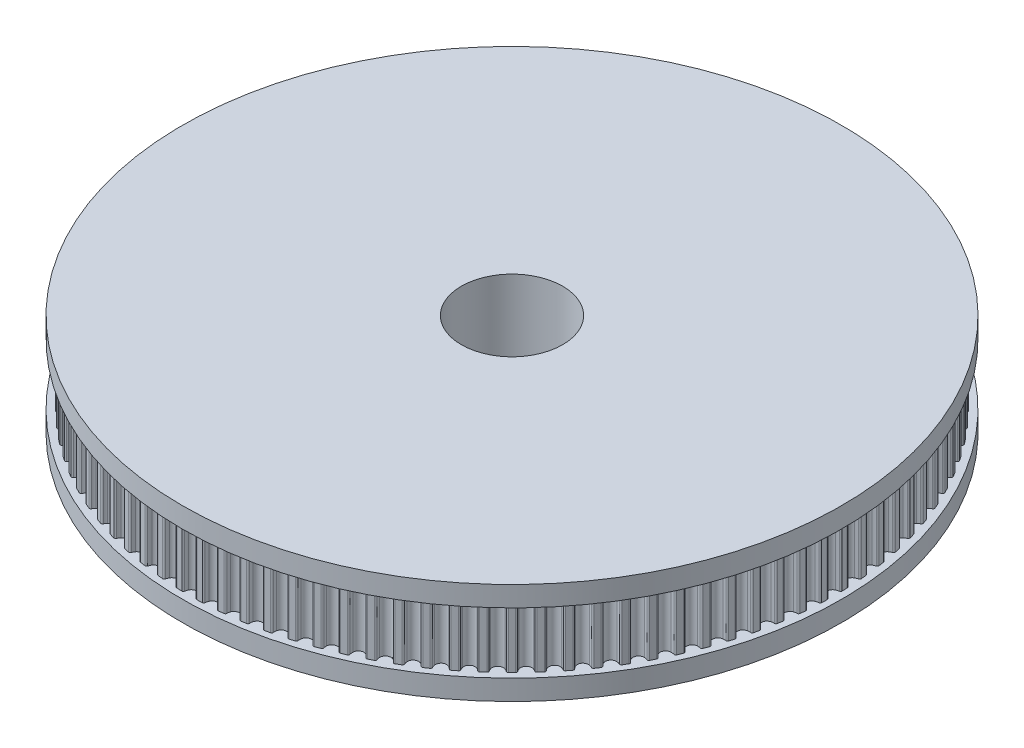
from build123d import *

# Parameters (mm, degrees)
SKETCH1_R           = 5
BOSS_EXTRUDE1_DEPTH = 12
SKETCH2_R           = 5
BOSS_EXTRUDE2_DEPTH = 8
SKETCH3_R           = 7.5
SKETCH3_R_2         = 5
BOSS_EXTRUDE3_DEPTH = 1
SKETCH4_R           = 32.5
SKETCH4_R_2         = 5
BOSS_EXTRUDE4_DEPTH = 1
SKETCH5_R           = 32.5
SKETCH5_R_2         = 5
BOSS_EXTRUDE5_DEPTH = 1


with BuildPart() as part:
    # Sketch1 → Boss-Extrude1 (new body)
    with BuildSketch(Plane(origin=(0, 0, 0), x_dir=(1, 0, 0), z_dir=(0, 1, 0))):
        with BuildLine():
            ThreePointArc((-0.582708394, 6.196392216), (-0.640340953, 6.292497599), (-0.748491413, 6.321844399))
            ThreePointArc((-0.748491413, 6.321844399), (-0.995861804, 6.287623976), (-1.24169972, 6.243727877))
            ThreePointArc((-1.24169972, 6.243727877), (-1.335488259, 6.182397082), (-1.360601883, 6.073185991))
            ThreePointArc((-1.360601883, 6.073185991), (-1.348626745, 5.941196423), (-1.354211129, 5.808782433))
            ThreePointArc((-1.354211129, 5.808782433), (-1.735130423, 5.340182339), (-2.31873683, 5.495389035))
            ThreePointArc((-2.31873683, 5.495389035), (-2.401085682, 5.599231785), (-2.468979114, 5.713052398))
            ThreePointArc((-2.468979114, 5.713052398), (-2.553489131, 5.786644609), (-2.66541499, 5.781134744))
            ThreePointArc((-2.66541499, 5.781134744), (-2.890103521, 5.672147533), (-3.110344632, 5.554431768))
            ThreePointArc((-3.110344632, 5.554431768), (-3.180590575, 5.467120463), (-3.170726968, 5.355494007))
            ThreePointArc((-3.170726968, 5.355494007), (-3.118550916, 5.233664989), (-3.082943807, 5.106006132))
            ThreePointArc((-3.082943807, 5.106006132), (-3.300414192, 4.542630423), (-3.903418375, 4.509896465))
            ThreePointArc((-3.903418375, 4.509896465), (-4.013825961, 4.583209594), (-4.113568955, 4.670479206))
            ThreePointArc((-4.113568955, 4.670479206), (-4.216684002, 4.714354526), (-4.321429178, 4.674527341))
            ThreePointArc((-4.321429178, 4.674527341), (-4.501441769, 4.501441769), (-4.674527341, 4.321429178))
            ThreePointArc((-4.674527341, 4.321429178), (-4.714354526, 4.216684002), (-4.670479206, 4.113568955))
            ThreePointArc((-4.670479206, 4.113568955), (-4.583209594, 4.013825961), (-4.509896465, 3.903418375))
            ThreePointArc((-4.509896465, 3.903418375), (-4.542630423, 3.300414192), (-5.106006132, 3.082943807))
            ThreePointArc((-5.106006132, 3.082943807), (-5.233664989, 3.118550916), (-5.355494007, 3.170726968))
            ThreePointArc((-5.355494007, 3.170726968), (-5.467120463, 3.180590575), (-5.554431768, 3.110344632))
            ThreePointArc((-5.554431768, 3.110344632), (-5.672147533, 2.890103521), (-5.781134744, 2.66541499))
            ThreePointArc((-5.781134744, 2.66541499), (-5.786644609, 2.553489131), (-5.713052398, 2.468979114))
            ThreePointArc((-5.713052398, 2.468979114), (-5.599231785, 2.401085682), (-5.495389035, 2.31873683))
            ThreePointArc((-5.495389035, 2.31873683), (-5.340182339, 1.735130423), (-5.808782433, 1.354211129))
            ThreePointArc((-5.808782433, 1.354211129), (-5.941196423, 1.348626745), (-6.073185991, 1.360601883))
            ThreePointArc((-6.073185991, 1.360601883), (-6.182397082, 1.335488259), (-6.243727877, 1.24169972))
            ThreePointArc((-6.243727877, 1.24169972), (-6.287623976, 0.995861804), (-6.321844399, 0.748491413))
            ThreePointArc((-6.321844399, 0.748491413), (-6.292497599, 0.640340953), (-6.196392216, 0.582708394))
            ThreePointArc((-6.196392216, 0.582708394), (-6.067162156, 0.553310407), (-5.942954637, 0.50708117))
            ThreePointArc((-5.942954637, 0.50708117), (-5.615, 0), (-5.942954637, -0.50708117))
            ThreePointArc((-5.942954637, -0.50708117), (-6.067162156, -0.553310407), (-6.196392216, -0.582708394))
            ThreePointArc((-6.196392216, -0.582708394), (-6.292497599, -0.640340953), (-6.321844399, -0.748491413))
            ThreePointArc((-6.321844399, -0.748491413), (-6.287623976, -0.995861804), (-6.243727877, -1.24169972))
            ThreePointArc((-6.243727877, -1.24169972), (-6.182397082, -1.335488259), (-6.073185991, -1.360601883))
            ThreePointArc((-6.073185991, -1.360601883), (-5.941196423, -1.348626745), (-5.808782433, -1.354211129))
            ThreePointArc((-5.808782433, -1.354211129), (-5.340182339, -1.735130423), (-5.495389035, -2.31873683))
            ThreePointArc((-5.495389035, -2.31873683), (-5.599231785, -2.401085682), (-5.713052398, -2.468979114))
            ThreePointArc((-5.713052398, -2.468979114), (-5.786644609, -2.553489131), (-5.781134744, -2.66541499))
            ThreePointArc((-5.781134744, -2.66541499), (-5.672147533, -2.890103521), (-5.554431768, -3.110344632))
            ThreePointArc((-5.554431768, -3.110344632), (-5.467120463, -3.180590575), (-5.355494007, -3.170726968))
            ThreePointArc((-5.355494007, -3.170726968), (-5.233664989, -3.118550916), (-5.106006132, -3.082943807))
            ThreePointArc((-5.106006132, -3.082943807), (-4.542630423, -3.300414192), (-4.509896465, -3.903418375))
            ThreePointArc((-4.509896465, -3.903418375), (-4.583209594, -4.013825961), (-4.670479206, -4.113568955))
            ThreePointArc((-4.670479206, -4.113568955), (-4.714354526, -4.216684002), (-4.674527341, -4.321429178))
            ThreePointArc((-4.674527341, -4.321429178), (-4.501441769, -4.501441769), (-4.321429178, -4.674527341))
            ThreePointArc((-4.321429178, -4.674527341), (-4.216684002, -4.714354526), (-4.113568955, -4.670479206))
            ThreePointArc((-4.113568955, -4.670479206), (-4.013825961, -4.583209594), (-3.903418375, -4.509896465))
            ThreePointArc((-3.903418375, -4.509896465), (-3.300414192, -4.542630423), (-3.082943807, -5.106006132))
            ThreePointArc((-3.082943807, -5.106006132), (-3.118550916, -5.233664989), (-3.170726968, -5.355494007))
            ThreePointArc((-3.170726968, -5.355494007), (-3.180590575, -5.467120463), (-3.110344632, -5.554431768))
            ThreePointArc((-3.110344632, -5.554431768), (-2.890103521, -5.672147533), (-2.66541499, -5.781134744))
            ThreePointArc((-2.66541499, -5.781134744), (-2.553489131, -5.786644609), (-2.468979114, -5.713052398))
            ThreePointArc((-2.468979114, -5.713052398), (-2.401085682, -5.599231785), (-2.31873683, -5.495389035))
            ThreePointArc((-2.31873683, -5.495389035), (-1.735130423, -5.340182339), (-1.354211129, -5.808782433))
            ThreePointArc((-1.354211129, -5.808782433), (-1.348626745, -5.941196423), (-1.360601883, -6.073185991))
            ThreePointArc((-1.360601883, -6.073185991), (-1.335488259, -6.182397082), (-1.24169972, -6.243727877))
            ThreePointArc((-1.24169972, -6.243727877), (-0.995861804, -6.287623976), (-0.748491413, -6.321844399))
            ThreePointArc((-0.748491413, -6.321844399), (-0.640340953, -6.292497599), (-0.582708394, -6.196392216))
            ThreePointArc((-0.582708394, -6.196392216), (-0.553310407, -6.067162156), (-0.50708117, -5.942954637))
            ThreePointArc((-0.50708117, -5.942954637), (0, -5.615), (0.50708117, -5.942954637))
            ThreePointArc((0.50708117, -5.942954637), (0.553310407, -6.067162156), (0.582708394, -6.196392216))
            ThreePointArc((0.582708394, -6.196392216), (0.640340953, -6.292497599), (0.748491413, -6.321844399))
            ThreePointArc((0.748491413, -6.321844399), (0.995861804, -6.287623976), (1.24169972, -6.243727877))
            ThreePointArc((1.24169972, -6.243727877), (1.335488259, -6.182397082), (1.360601883, -6.073185991))
            ThreePointArc((1.360601883, -6.073185991), (1.348626745, -5.941196423), (1.354211129, -5.808782433))
            ThreePointArc((1.354211129, -5.808782433), (1.735130423, -5.340182339), (2.31873683, -5.495389035))
            ThreePointArc((2.31873683, -5.495389035), (2.401085682, -5.599231785), (2.468979114, -5.713052398))
            ThreePointArc((2.468979114, -5.713052398), (2.553489131, -5.786644609), (2.66541499, -5.781134744))
            ThreePointArc((2.66541499, -5.781134744), (2.890103521, -5.672147533), (3.110344632, -5.554431768))
            ThreePointArc((3.110344632, -5.554431768), (3.180590575, -5.467120463), (3.170726968, -5.355494007))
            ThreePointArc((3.170726968, -5.355494007), (3.118550916, -5.233664989), (3.082943807, -5.106006132))
            ThreePointArc((3.082943807, -5.106006132), (3.300414192, -4.542630423), (3.903418375, -4.509896465))
            ThreePointArc((3.903418375, -4.509896465), (4.013825961, -4.583209594), (4.113568955, -4.670479206))
            ThreePointArc((4.113568955, -4.670479206), (4.216684002, -4.714354526), (4.321429178, -4.674527341))
            ThreePointArc((4.321429178, -4.674527341), (4.501441769, -4.501441769), (4.674527341, -4.321429178))
            ThreePointArc((4.674527341, -4.321429178), (4.714354526, -4.216684002), (4.670479206, -4.113568955))
            ThreePointArc((4.670479206, -4.113568955), (4.583209594, -4.013825961), (4.509896465, -3.903418375))
            ThreePointArc((4.509896465, -3.903418375), (4.542630423, -3.300414192), (5.106006132, -3.082943807))
            ThreePointArc((5.106006132, -3.082943807), (5.233664989, -3.118550916), (5.355494007, -3.170726968))
            ThreePointArc((5.355494007, -3.170726968), (5.467120463, -3.180590575), (5.554431768, -3.110344632))
            ThreePointArc((5.554431768, -3.110344632), (5.672147533, -2.890103521), (5.781134744, -2.66541499))
            ThreePointArc((5.781134744, -2.66541499), (5.786644609, -2.553489131), (5.713052398, -2.468979114))
            ThreePointArc((5.713052398, -2.468979114), (5.599231785, -2.401085682), (5.495389035, -2.31873683))
            ThreePointArc((5.495389035, -2.31873683), (5.340182339, -1.735130423), (5.808782433, -1.354211129))
            ThreePointArc((5.808782433, -1.354211129), (5.941196423, -1.348626745), (6.073185991, -1.360601883))
            ThreePointArc((6.073185991, -1.360601883), (6.182397082, -1.335488259), (6.243727877, -1.24169972))
            ThreePointArc((6.243727877, -1.24169972), (6.287623976, -0.995861804), (6.321844399, -0.748491413))
            ThreePointArc((6.321844399, -0.748491413), (6.292497599, -0.640340953), (6.196392216, -0.582708394))
            ThreePointArc((6.196392216, -0.582708394), (6.067162156, -0.553310407), (5.942954637, -0.50708117))
            ThreePointArc((5.942954637, -0.50708117), (5.615, 0), (5.942954637, 0.50708117))
            ThreePointArc((5.942954637, 0.50708117), (6.067162156, 0.553310407), (6.196392216, 0.582708394))
            ThreePointArc((6.196392216, 0.582708394), (6.292497599, 0.640340953), (6.321844399, 0.748491413))
            ThreePointArc((6.321844399, 0.748491413), (6.287623976, 0.995861804), (6.243727877, 1.24169972))
            ThreePointArc((6.243727877, 1.24169972), (6.182397082, 1.335488259), (6.073185991, 1.360601883))
            ThreePointArc((6.073185991, 1.360601883), (5.941196423, 1.348626745), (5.808782433, 1.354211129))
            ThreePointArc((5.808782433, 1.354211129), (5.340182339, 1.735130423), (5.495389035, 2.31873683))
            ThreePointArc((5.495389035, 2.31873683), (5.599231785, 2.401085682), (5.713052398, 2.468979114))
            ThreePointArc((5.713052398, 2.468979114), (5.786644609, 2.553489131), (5.781134744, 2.66541499))
            ThreePointArc((5.781134744, 2.66541499), (5.672147533, 2.890103521), (5.554431768, 3.110344632))
            ThreePointArc((5.554431768, 3.110344632), (5.467120463, 3.180590575), (5.355494007, 3.170726968))
            ThreePointArc((5.355494007, 3.170726968), (5.233664989, 3.118550916), (5.106006132, 3.082943807))
            ThreePointArc((5.106006132, 3.082943807), (4.542630423, 3.300414192), (4.509896465, 3.903418375))
            ThreePointArc((4.509896465, 3.903418375), (4.583209594, 4.013825961), (4.670479206, 4.113568955))
            ThreePointArc((4.670479206, 4.113568955), (4.714354526, 4.216684002), (4.674527341, 4.321429178))
            ThreePointArc((4.674527341, 4.321429178), (4.501441769, 4.501441769), (4.321429178, 4.674527341))
            ThreePointArc((4.321429178, 4.674527341), (4.216684002, 4.714354526), (4.113568955, 4.670479206))
            ThreePointArc((4.113568955, 4.670479206), (4.013825961, 4.583209594), (3.903418375, 4.509896465))
            ThreePointArc((3.903418375, 4.509896465), (3.300414192, 4.542630423), (3.082943807, 5.106006132))
            ThreePointArc((3.082943807, 5.106006132), (3.118550916, 5.233664989), (3.170726968, 5.355494007))
            ThreePointArc((3.170726968, 5.355494007), (3.180590575, 5.467120463), (3.110344632, 5.554431768))
            ThreePointArc((3.110344632, 5.554431768), (2.890103521, 5.672147533), (2.66541499, 5.781134744))
            ThreePointArc((2.66541499, 5.781134744), (2.553489131, 5.786644609), (2.468979114, 5.713052398))
            ThreePointArc((2.468979114, 5.713052398), (2.401085682, 5.599231785), (2.31873683, 5.495389035))
            ThreePointArc((2.31873683, 5.495389035), (1.735130423, 5.340182339), (1.354211129, 5.808782433))
            ThreePointArc((1.354211129, 5.808782433), (1.348626745, 5.941196423), (1.360601883, 6.073185991))
            ThreePointArc((1.360601883, 6.073185991), (1.335488259, 6.182397082), (1.24169972, 6.243727877))
            ThreePointArc((1.24169972, 6.243727877), (0.995861804, 6.287623976), (0.748491413, 6.321844399))
            ThreePointArc((0.748491413, 6.321844399), (0.640340953, 6.292497599), (0.582708394, 6.196392216))
            ThreePointArc((0.582708394, 6.196392216), (0.553310407, 6.067162156), (0.50708117, 5.942954637))
            ThreePointArc((0.50708117, 5.942954637), (0, 5.615), (-0.50708117, 5.942954637))
            ThreePointArc((-0.50708117, 5.942954637), (-0.553310407, 6.067162156), (-0.582708394, 6.196392216))
        make_face()
        Circle(SKETCH1_R, mode=Mode.SUBTRACT)
    extrude(amount=BOSS_EXTRUDE1_DEPTH)

    # Sketch2 → Boss-Extrude2 (add)
    with BuildSketch(Plane(origin=(0, 12, 0), x_dir=(1, 0, 0), z_dir=(0, 1, 0))):
        with BuildLine():
            ThreePointArc((-0.590636451, 31.691736076), (-0.641969208, 31.785552728), (-0.742748164, 31.821332863))
            ThreePointArc((-0.742748164, 31.821332863), (-0.999804461, 31.814293816), (-1.256795502, 31.805178274))
            ThreePointArc((-1.256795502, 31.805178274), (-1.355128941, 31.76314078), (-1.400469608, 31.666286044))
            ThreePointArc((-1.400469608, 31.666286044), (-1.423990757, 31.512112674), (-1.471197102, 31.363471383))
            ThreePointArc((-1.471197102, 31.363471383), (-1.951466556, 31.017672693), (-2.471289011, 31.300550933))
            ThreePointArc((-2.471289011, 31.300550933), (-2.536752813, 31.44210362), (-2.579411538, 31.592113305))
            ThreePointArc((-2.579411538, 31.592113305), (-2.636533798, 31.68252162), (-2.739360543, 31.711903188))
            ThreePointArc((-2.739360543, 31.711903188), (-2.995467613, 31.688737333), (-3.251379171, 31.663503178))
            ThreePointArc((-3.251379171, 31.663503178), (-3.346879015, 31.615374228), (-3.386048654, 31.515863648))
            ThreePointArc((-3.386048654, 31.515863648), (-3.399842763, 31.360517599), (-3.437622693, 31.209205506))
            ThreePointArc((-3.437622693, 31.209205506), (-3.895231566, 30.833932802), (-4.431790341, 31.083612925))
            ThreePointArc((-4.431790341, 31.083612925), (-4.506013132, 31.220775784), (-4.558006866, 31.367810895))
            ThreePointArc((-4.558006866, 31.367810895), (-4.620693193, 31.454454074), (-4.725161917, 31.477321119))
            ThreePointArc((-4.725161917, 31.477321119), (-4.979309022, 31.438119881), (-5.233131132, 31.3968667))
            ThreePointArc((-5.233131132, 31.3968667), (-5.325420487, 31.342836236), (-5.358264512, 31.241062536))
            ThreePointArc((-5.358264512, 31.241062536), (-5.362277143, 31.085156887), (-5.390481557, 30.931771153))
            ThreePointArc((-5.390481557, 30.931771153), (-5.823623876, 30.528505465), (-6.37480142, 30.744002097))
            ThreePointArc((-6.37480142, 30.744002097), (-6.457490276, 30.876233809), (-6.518613823, 31.019714067))
            ThreePointArc((-6.518613823, 31.019714067), (-6.586616823, 31.102250168), (-6.692315236, 31.118512445))
            ThreePointArc((-6.692315236, 31.118512445), (-6.943499374, 31.063430533), (-7.194230314, 31.006321133))
            ThreePointArc((-7.194230314, 31.006321133), (-7.282944957, 30.946602389), (-7.309333748, 30.842967223))
            ThreePointArc((-7.309333748, 30.842967223), (-7.303549064, 30.687117263), (-7.322066654, 30.532263231))
            ThreePointArc((-7.322066654, 30.532263231), (-7.729033003, 30.102596065), (-8.29265407, 30.283058739))
            ThreePointArc((-8.29265407, 30.283058739), (-8.383482656, 30.409837445), (-8.453494789, 30.549196598))
            ThreePointArc((-8.453494789, 30.549196598), (-8.526546086, 30.62729989), (-8.633057044, 30.636893218))
            ThreePointArc((-8.633057044, 30.636893218), (-8.880286905, 30.566148015), (-9.126937157, 30.493407782))
            ThreePointArc((-9.126937157, 30.493407782), (-9.21172697, 30.428236441), (-9.231556384, 30.323148809))
            ThreePointArc((-9.231556384, 30.323148809), (-9.215997214, 30.167969607), (-9.224754899, 30.012258415))
            ThreePointArc((-9.224754899, 30.012258415), (-9.603939168, 29.55788547), (-10.177779402, 29.702601983))
            ThreePointArc((-10.177779402, 29.702601983), (-10.27638926, 29.823427346), (-10.355013674, 29.958115407))
            ThreePointArc((-10.355013674, 29.958115407), (-10.432824967, 30.031477651), (-10.53972812, 30.034364171))
            ThreePointArc((-10.53972812, 30.034364171), (-10.782028001, 29.948234876), (-11.023624148, 29.860150881))
            ThreePointArc((-11.023624148, 29.860150881), (-11.104154506, 29.789784145), (-11.117346283, 29.68365878))
            ThreePointArc((-11.117346283, 29.68365878), (-11.092074034, 29.529762757), (-11.09103725, 29.373808926))
            ThreePointArc((-11.09103725, 29.373808926), (-11.440942973, 28.896523405), (-12.022737689, 29.004922626))
            ThreePointArc((-12.022737689, 29.004922626), (-12.128739651, 29.119317804), (-12.21566605, 29.248803222))
            ThreePointArc((-12.21566605, 29.248803222), (-12.297930254, 29.31713489), (-12.404803704, 29.31330321))
            ThreePointArc((-12.404803704, 29.31330321), (-12.641217359, 29.212129736), (-12.876805931, 29.109049607))
            ThreePointArc((-12.876805931, 29.109049607), (-12.952759016, 29.03376518), (-12.959261096, 28.927020911))
            ThreePointArc((-12.959261096, 28.927020911), (-12.924375505, 28.775015425), (-12.913548345, 28.619434433))
            ThreePointArc((-12.913548345, 28.619434433), (-13.232794603, 28.121119964), (-13.820247723, 28.192774091))
            ThreePointArc((-13.820247723, 28.192774091), (-13.933223447, 28.300287618), (-14.028108774, 28.424059372))
            ThreePointArc((-14.028108774, 28.424059372), (-14.114501229, 28.487090791), (-14.220923195, 28.476556033))
            ThreePointArc((-14.220923195, 28.476556033), (-14.450517607, 28.360737665), (-14.679168844, 28.243068213))
            ThreePointArc((-14.679168844, 28.243068213), (-14.750244905, 28.163163209), (-14.750031626, 28.056221306))
            ThreePointArc((-14.750031626, 28.056221306), (-14.70567037, 27.906706252), (-14.685095564, 27.752112107))
            ThreePointArc((-14.685095564, 27.752112107), (-14.972422437, 27.234735309), (-15.563215554, 27.269361557))
            ThreePointArc((-15.563215554, 27.269361557), (-15.682719175, 27.369569126), (-15.785188961, 27.487138746))
            ThreePointArc((-15.785188961, 27.487138746), (-15.875368715, 27.54462116), (-15.980919199, 27.527424899))
            ThreePointArc((-15.980919199, 27.527424899), (-16.202788263, 27.39741872), (-16.423599783, 27.265624331))
            ThreePointArc((-16.423599783, 27.265624331), (-16.489518315, 27.181414099), (-16.48259052, 27.074696613))
            ThreePointArc((-16.48259052, 27.074696613), (-16.428928672, 26.92826206), (-16.398687419, 26.775264873))
            ThreePointArc((-16.398687419, 26.775264873), (-16.652960961, 26.240867597), (-17.244762482, 26.238329311))
            ThreePointArc((-17.244762482, 26.238329311), (-17.370322376, 26.330835449), (-17.479972218, 26.441738941))
            ThreePointArc((-17.479972218, 26.441738941), (-17.573583374, 26.493445493), (-17.677845816, 26.469655595))
            ThreePointArc((-17.677845816, 26.469655595), (-17.891113917, 26.325974679), (-18.103214278, 26.180575487))
            ThreePointArc((-18.103214278, 26.180575487), (-18.16371513, 26.092392365), (-18.150100159, 25.986320462))
            ThreePointArc((-18.150100159, 25.986320462), (-18.087349499, 25.843544319), (-18.047561148, 25.692747902))
            ThreePointArc((-18.047561148, 25.692747902), (-18.267777856, 25.143439168), (-18.858252212, 25.103746366))
            ThreePointArc((-18.858252212, 25.103746366), (-18.98937285, 25.188185993), (-19.105770011, 25.291985672))
            ThreePointArc((-19.105770011, 25.291985672), (-19.202443128, 25.3377123), (-19.305006052, 25.307422653))
            ThreePointArc((-19.305006052, 25.307422653), (-19.508831518, 25.150634044), (-19.711383656, 24.992203872))
            ThreePointArc((-19.711383656, 24.992203872), (-19.76622806, 24.90039588), (-19.745979645, 24.795388176))
            ThreePointArc((-19.745979645, 24.795388176), (-19.674387821, 24.656833916), (-19.625209397, 24.508833392))
            ThreePointArc((-19.625209397, 24.508833392), (-19.810500177, 23.946781072), (-20.397317035, 23.870090404))
            ThreePointArc((-20.397317035, 23.870090404), (-20.533480945, 23.946130275), (-20.656166059, 24.042416491))
            ThreePointArc((-20.656166059, 24.042416491), (-20.755519612, 24.081982732), (-20.855978249, 24.045312875))
            ThreePointArc((-20.855978249, 24.045312875), (-21.049556673, 23.876035346), (-21.241761208, 23.705199446))
            ThreePointArc((-21.241761208, 23.705199446), (-21.290732718, 23.610128907), (-21.26393077, 23.506599821))
            ThreePointArc((-21.26393077, 23.506599821), (-21.183780322, 23.372814254), (-21.125405911, 23.228193714))
            ThreePointArc((-21.125405911, 23.228193714), (-21.275039505, 22.655615972), (-21.855882967, 22.542230099))
            ThreePointArc((-21.855882967, 22.542230099), (-21.996552772, 22.609570121), (-22.125041656, 22.697962875))
            ThreePointArc((-22.125041656, 22.697962875), (-22.226683543, 22.731212581), (-22.324641428, 22.688307234))
            ThreePointArc((-22.324641428, 22.688307234), (-22.507208845, 22.507208845), (-22.688307234, 22.324641428))
            ThreePointArc((-22.688307234, 22.324641428), (-22.731212581, 22.226683543), (-22.697962875, 22.125041656))
            ThreePointArc((-22.697962875, 22.125041656), (-22.609570121, 21.996552772), (-22.542230099, 21.855882967))
            ThreePointArc((-22.542230099, 21.855882967), (-22.655615972, 21.275039505), (-23.228193714, 21.125405911))
            ThreePointArc((-23.228193714, 21.125405911), (-23.372814254, 21.183780322), (-23.506599821, 21.26393077))
            ThreePointArc((-23.506599821, 21.26393077), (-23.610128907, 21.290732718), (-23.705199446, 21.241761208))
            ThreePointArc((-23.705199446, 21.241761208), (-23.876035346, 21.049556673), (-24.045312875, 20.855978249))
            ThreePointArc((-24.045312875, 20.855978249), (-24.081982732, 20.755519612), (-24.042416491, 20.656166059))
            ThreePointArc((-24.042416491, 20.656166059), (-23.946130275, 20.533480945), (-23.870090404, 20.397317035))
            ThreePointArc((-23.870090404, 20.397317035), (-23.946781072, 19.810500177), (-24.508833392, 19.625209397))
            ThreePointArc((-24.508833392, 19.625209397), (-24.656833916, 19.674387821), (-24.795388176, 19.745979645))
            ThreePointArc((-24.795388176, 19.745979645), (-24.90039588, 19.76622806), (-24.992203872, 19.711383656))
            ThreePointArc((-24.992203872, 19.711383656), (-25.150634044, 19.508831518), (-25.307422653, 19.305006052))
            ThreePointArc((-25.307422653, 19.305006052), (-25.3377123, 19.202443128), (-25.291985672, 19.105770011))
            ThreePointArc((-25.291985672, 19.105770011), (-25.188185993, 18.98937285), (-25.103746366, 18.858252212))
            ThreePointArc((-25.103746366, 18.858252212), (-25.143439168, 18.267777856), (-25.692747902, 18.047561148))
            ThreePointArc((-25.692747902, 18.047561148), (-25.843544319, 18.087349499), (-25.986320462, 18.150100159))
            ThreePointArc((-25.986320462, 18.150100159), (-26.092392365, 18.16371513), (-26.180575487, 18.103214278))
            ThreePointArc((-26.180575487, 18.103214278), (-26.325974679, 17.891113917), (-26.469655595, 17.677845816))
            ThreePointArc((-26.469655595, 17.677845816), (-26.493445493, 17.573583374), (-26.441738941, 17.479972218))
            ThreePointArc((-26.441738941, 17.479972218), (-26.330835449, 17.370322376), (-26.238329311, 17.244762482))
            ThreePointArc((-26.238329311, 17.244762482), (-26.240867597, 16.652960961), (-26.775264873, 16.398687419))
            ThreePointArc((-26.775264873, 16.398687419), (-26.92826206, 16.428928672), (-27.074696613, 16.48259052))
            ThreePointArc((-27.074696613, 16.48259052), (-27.181414099, 16.489518315), (-27.265624331, 16.423599783))
            ThreePointArc((-27.265624331, 16.423599783), (-27.39741872, 16.202788263), (-27.527424899, 15.980919199))
            ThreePointArc((-27.527424899, 15.980919199), (-27.54462116, 15.875368715), (-27.487138746, 15.785188961))
            ThreePointArc((-27.487138746, 15.785188961), (-27.369569126, 15.682719175), (-27.269361557, 15.563215554))
            ThreePointArc((-27.269361557, 15.563215554), (-27.234735309, 14.972422437), (-27.752112107, 14.685095564))
            ThreePointArc((-27.752112107, 14.685095564), (-27.906706252, 14.70567037), (-28.056221306, 14.750031626))
            ThreePointArc((-28.056221306, 14.750031626), (-28.163163209, 14.750244905), (-28.243068213, 14.679168844))
            ThreePointArc((-28.243068213, 14.679168844), (-28.360737665, 14.450517607), (-28.476556033, 14.220923195))
            ThreePointArc((-28.476556033, 14.220923195), (-28.487090791, 14.114501229), (-28.424059372, 14.028108774))
            ThreePointArc((-28.424059372, 14.028108774), (-28.300287618, 13.933223447), (-28.192774091, 13.820247723))
            ThreePointArc((-28.192774091, 13.820247723), (-28.121119964, 13.232794603), (-28.619434433, 12.913548345))
            ThreePointArc((-28.619434433, 12.913548345), (-28.775015425, 12.924375505), (-28.927020911, 12.959261096))
            ThreePointArc((-28.927020911, 12.959261096), (-29.03376518, 12.952759016), (-29.109049607, 12.876805931))
            ThreePointArc((-29.109049607, 12.876805931), (-29.212129736, 12.641217359), (-29.31330321, 12.404803704))
            ThreePointArc((-29.31330321, 12.404803704), (-29.31713489, 12.297930254), (-29.248803222, 12.21566605))
            ThreePointArc((-29.248803222, 12.21566605), (-29.119317804, 12.128739651), (-29.004922626, 12.022737689))
            ThreePointArc((-29.004922626, 12.022737689), (-28.896523405, 11.440942973), (-29.373808926, 11.09103725))
            ThreePointArc((-29.373808926, 11.09103725), (-29.529762757, 11.092074034), (-29.68365878, 11.117346283))
            ThreePointArc((-29.68365878, 11.117346283), (-29.789784145, 11.104154506), (-29.860150881, 11.023624148))
            ThreePointArc((-29.860150881, 11.023624148), (-29.948234876, 10.782028001), (-30.034364171, 10.53972812))
            ThreePointArc((-30.034364171, 10.53972812), (-30.031477651, 10.432824967), (-29.958115407, 10.355013674))
            ThreePointArc((-29.958115407, 10.355013674), (-29.823427346, 10.27638926), (-29.702601983, 10.177779402))
            ThreePointArc((-29.702601983, 10.177779402), (-29.55788547, 9.603939168), (-30.012258415, 9.224754899))
            ThreePointArc((-30.012258415, 9.224754899), (-30.167969607, 9.215997214), (-30.323148809, 9.231556384))
            ThreePointArc((-30.323148809, 9.231556384), (-30.428236441, 9.21172697), (-30.493407782, 9.126937157))
            ThreePointArc((-30.493407782, 9.126937157), (-30.566148015, 8.880286905), (-30.636893218, 8.633057044))
            ThreePointArc((-30.636893218, 8.633057044), (-30.62729989, 8.526546086), (-30.549196598, 8.453494789))
            ThreePointArc((-30.549196598, 8.453494789), (-30.409837445, 8.383482656), (-30.283058739, 8.29265407))
            ThreePointArc((-30.283058739, 8.29265407), (-30.102596065, 7.729033003), (-30.532263231, 7.322066654))
            ThreePointArc((-30.532263231, 7.322066654), (-30.687117263, 7.303549064), (-30.842967223, 7.309333748))
            ThreePointArc((-30.842967223, 7.309333748), (-30.946602389, 7.282944957), (-31.006321133, 7.194230314))
            ThreePointArc((-31.006321133, 7.194230314), (-31.063430533, 6.943499374), (-31.118512445, 6.692315236))
            ThreePointArc((-31.118512445, 6.692315236), (-31.102250168, 6.586616823), (-31.019714067, 6.518613823))
            ThreePointArc((-31.019714067, 6.518613823), (-30.876233809, 6.457490276), (-30.744002097, 6.37480142))
            ThreePointArc((-30.744002097, 6.37480142), (-30.528505465, 5.823623876), (-30.931771153, 5.390481557))
            ThreePointArc((-30.931771153, 5.390481557), (-31.085156887, 5.362277143), (-31.241062536, 5.358264512))
            ThreePointArc((-31.241062536, 5.358264512), (-31.342836236, 5.325420487), (-31.3968667, 5.233131132))
            ThreePointArc((-31.3968667, 5.233131132), (-31.438119881, 4.979309022), (-31.477321119, 4.725161917))
            ThreePointArc((-31.477321119, 4.725161917), (-31.454454074, 4.620693193), (-31.367810895, 4.558006866))
            ThreePointArc((-31.367810895, 4.558006866), (-31.220775784, 4.506013132), (-31.083612925, 4.431790341))
            ThreePointArc((-31.083612925, 4.431790341), (-30.833932802, 3.895231566), (-31.209205506, 3.437622693))
            ThreePointArc((-31.209205506, 3.437622693), (-31.360517599, 3.399842763), (-31.515863648, 3.386048654))
            ThreePointArc((-31.515863648, 3.386048654), (-31.615374228, 3.346879015), (-31.663503178, 3.251379171))
            ThreePointArc((-31.663503178, 3.251379171), (-31.688737333, 2.995467613), (-31.711903188, 2.739360543))
            ThreePointArc((-31.711903188, 2.739360543), (-31.68252162, 2.636533798), (-31.592113305, 2.579411538))
            ThreePointArc((-31.592113305, 2.579411538), (-31.44210362, 2.536752813), (-31.300550933, 2.471289011))
            ThreePointArc((-31.300550933, 2.471289011), (-31.017672693, 1.951466556), (-31.363471383, 1.471197102))
            ThreePointArc((-31.363471383, 1.471197102), (-31.512112674, 1.423990757), (-31.666286044, 1.400469608))
            ThreePointArc((-31.666286044, 1.400469608), (-31.76314078, 1.355128941), (-31.805178274, 1.256795502))
            ThreePointArc((-31.805178274, 1.256795502), (-31.814293816, 0.999804461), (-31.821332863, 0.742748164))
            ThreePointArc((-31.821332863, 0.742748164), (-31.785552728, 0.641969208), (-31.691736076, 0.590636451))
            ThreePointArc((-31.691736076, 0.590636451), (-31.539343838, 0.55748109), (-31.393959967, 0.501034632))
            ThreePointArc((-31.393959967, 0.501034632), (-31.079, 0), (-31.393959967, -0.501034632))
            ThreePointArc((-31.393959967, -0.501034632), (-31.539343838, -0.55748109), (-31.691736076, -0.590636451))
            ThreePointArc((-31.691736076, -0.590636451), (-31.785552728, -0.641969208), (-31.821332863, -0.742748164))
            ThreePointArc((-31.821332863, -0.742748164), (-31.814293816, -0.999804461), (-31.805178274, -1.256795502))
            ThreePointArc((-31.805178274, -1.256795502), (-31.76314078, -1.355128941), (-31.666286044, -1.400469608))
            ThreePointArc((-31.666286044, -1.400469608), (-31.512112674, -1.423990757), (-31.363471383, -1.471197102))
            ThreePointArc((-31.363471383, -1.471197102), (-31.017672693, -1.951466556), (-31.300550933, -2.471289011))
            ThreePointArc((-31.300550933, -2.471289011), (-31.44210362, -2.536752813), (-31.592113305, -2.579411538))
            ThreePointArc((-31.592113305, -2.579411538), (-31.68252162, -2.636533798), (-31.711903188, -2.739360543))
            ThreePointArc((-31.711903188, -2.739360543), (-31.688737333, -2.995467613), (-31.663503178, -3.251379171))
            ThreePointArc((-31.663503178, -3.251379171), (-31.615374228, -3.346879015), (-31.515863648, -3.386048654))
            ThreePointArc((-31.515863648, -3.386048654), (-31.360517599, -3.399842763), (-31.209205506, -3.437622693))
            ThreePointArc((-31.209205506, -3.437622693), (-30.833932802, -3.895231566), (-31.083612925, -4.431790341))
            ThreePointArc((-31.083612925, -4.431790341), (-31.220775784, -4.506013132), (-31.367810895, -4.558006866))
            ThreePointArc((-31.367810895, -4.558006866), (-31.454454074, -4.620693193), (-31.477321119, -4.725161917))
            ThreePointArc((-31.477321119, -4.725161917), (-31.438119881, -4.979309022), (-31.3968667, -5.233131132))
            ThreePointArc((-31.3968667, -5.233131132), (-31.342836236, -5.325420487), (-31.241062536, -5.358264512))
            ThreePointArc((-31.241062536, -5.358264512), (-31.085156887, -5.362277143), (-30.931771153, -5.390481557))
            ThreePointArc((-30.931771153, -5.390481557), (-30.528505465, -5.823623876), (-30.744002097, -6.37480142))
            ThreePointArc((-30.744002097, -6.37480142), (-30.876233809, -6.457490276), (-31.019714067, -6.518613823))
            ThreePointArc((-31.019714067, -6.518613823), (-31.102250168, -6.586616823), (-31.118512445, -6.692315236))
            ThreePointArc((-31.118512445, -6.692315236), (-31.063430533, -6.943499374), (-31.006321133, -7.194230314))
            ThreePointArc((-31.006321133, -7.194230314), (-30.946602389, -7.282944957), (-30.842967223, -7.309333748))
            ThreePointArc((-30.842967223, -7.309333748), (-30.687117263, -7.303549064), (-30.532263231, -7.322066654))
            ThreePointArc((-30.532263231, -7.322066654), (-30.102596065, -7.729033003), (-30.283058739, -8.29265407))
            ThreePointArc((-30.283058739, -8.29265407), (-30.409837445, -8.383482656), (-30.549196598, -8.453494789))
            ThreePointArc((-30.549196598, -8.453494789), (-30.62729989, -8.526546086), (-30.636893218, -8.633057044))
            ThreePointArc((-30.636893218, -8.633057044), (-30.566148015, -8.880286905), (-30.493407782, -9.126937157))
            ThreePointArc((-30.493407782, -9.126937157), (-30.428236441, -9.21172697), (-30.323148809, -9.231556384))
            ThreePointArc((-30.323148809, -9.231556384), (-30.167969607, -9.215997214), (-30.012258415, -9.224754899))
            ThreePointArc((-30.012258415, -9.224754899), (-29.55788547, -9.603939168), (-29.702601983, -10.177779402))
            ThreePointArc((-29.702601983, -10.177779402), (-29.823427346, -10.27638926), (-29.958115407, -10.355013674))
            ThreePointArc((-29.958115407, -10.355013674), (-30.031477651, -10.432824967), (-30.034364171, -10.53972812))
            ThreePointArc((-30.034364171, -10.53972812), (-29.948234876, -10.782028001), (-29.860150881, -11.023624148))
            ThreePointArc((-29.860150881, -11.023624148), (-29.789784145, -11.104154506), (-29.68365878, -11.117346283))
            ThreePointArc((-29.68365878, -11.117346283), (-29.529762757, -11.092074034), (-29.373808926, -11.09103725))
            ThreePointArc((-29.373808926, -11.09103725), (-28.896523405, -11.440942973), (-29.004922626, -12.022737689))
            ThreePointArc((-29.004922626, -12.022737689), (-29.119317804, -12.128739651), (-29.248803222, -12.21566605))
            ThreePointArc((-29.248803222, -12.21566605), (-29.31713489, -12.297930254), (-29.31330321, -12.404803704))
            ThreePointArc((-29.31330321, -12.404803704), (-29.212129736, -12.641217359), (-29.109049607, -12.876805931))
            ThreePointArc((-29.109049607, -12.876805931), (-29.03376518, -12.952759016), (-28.927020911, -12.959261096))
            ThreePointArc((-28.927020911, -12.959261096), (-28.775015425, -12.924375505), (-28.619434433, -12.913548345))
            ThreePointArc((-28.619434433, -12.913548345), (-28.121119964, -13.232794603), (-28.192774091, -13.820247723))
            ThreePointArc((-28.192774091, -13.820247723), (-28.300287618, -13.933223447), (-28.424059372, -14.028108774))
            ThreePointArc((-28.424059372, -14.028108774), (-28.487090791, -14.114501229), (-28.476556033, -14.220923195))
            ThreePointArc((-28.476556033, -14.220923195), (-28.360737665, -14.450517607), (-28.243068213, -14.679168844))
            ThreePointArc((-28.243068213, -14.679168844), (-28.163163209, -14.750244905), (-28.056221306, -14.750031626))
            ThreePointArc((-28.056221306, -14.750031626), (-27.906706252, -14.70567037), (-27.752112107, -14.685095564))
            ThreePointArc((-27.752112107, -14.685095564), (-27.234735309, -14.972422437), (-27.269361557, -15.563215554))
            ThreePointArc((-27.269361557, -15.563215554), (-27.369569126, -15.682719175), (-27.487138746, -15.785188961))
            ThreePointArc((-27.487138746, -15.785188961), (-27.54462116, -15.875368715), (-27.527424899, -15.980919199))
            ThreePointArc((-27.527424899, -15.980919199), (-27.39741872, -16.202788263), (-27.265624331, -16.423599783))
            ThreePointArc((-27.265624331, -16.423599783), (-27.181414099, -16.489518315), (-27.074696613, -16.48259052))
            ThreePointArc((-27.074696613, -16.48259052), (-26.92826206, -16.428928672), (-26.775264873, -16.398687419))
            ThreePointArc((-26.775264873, -16.398687419), (-26.240867597, -16.652960961), (-26.238329311, -17.244762482))
            ThreePointArc((-26.238329311, -17.244762482), (-26.330835449, -17.370322376), (-26.441738941, -17.479972218))
            ThreePointArc((-26.441738941, -17.479972218), (-26.493445493, -17.573583374), (-26.469655595, -17.677845816))
            ThreePointArc((-26.469655595, -17.677845816), (-26.325974679, -17.891113917), (-26.180575487, -18.103214278))
            ThreePointArc((-26.180575487, -18.103214278), (-26.092392365, -18.16371513), (-25.986320462, -18.150100159))
            ThreePointArc((-25.986320462, -18.150100159), (-25.843544319, -18.087349499), (-25.692747902, -18.047561148))
            ThreePointArc((-25.692747902, -18.047561148), (-25.143439168, -18.267777856), (-25.103746366, -18.858252212))
            ThreePointArc((-25.103746366, -18.858252212), (-25.188185993, -18.98937285), (-25.291985672, -19.105770011))
            ThreePointArc((-25.291985672, -19.105770011), (-25.3377123, -19.202443128), (-25.307422653, -19.305006052))
            ThreePointArc((-25.307422653, -19.305006052), (-25.150634044, -19.508831518), (-24.992203872, -19.711383656))
            ThreePointArc((-24.992203872, -19.711383656), (-24.90039588, -19.76622806), (-24.795388176, -19.745979645))
            ThreePointArc((-24.795388176, -19.745979645), (-24.656833916, -19.674387821), (-24.508833392, -19.625209397))
            ThreePointArc((-24.508833392, -19.625209397), (-23.946781072, -19.810500177), (-23.870090404, -20.397317035))
            ThreePointArc((-23.870090404, -20.397317035), (-23.946130275, -20.533480945), (-24.042416491, -20.656166059))
            ThreePointArc((-24.042416491, -20.656166059), (-24.081982732, -20.755519612), (-24.045312875, -20.855978249))
            ThreePointArc((-24.045312875, -20.855978249), (-23.876035346, -21.049556673), (-23.705199446, -21.241761208))
            ThreePointArc((-23.705199446, -21.241761208), (-23.610128907, -21.290732718), (-23.506599821, -21.26393077))
            ThreePointArc((-23.506599821, -21.26393077), (-23.372814254, -21.183780322), (-23.228193714, -21.125405911))
            ThreePointArc((-23.228193714, -21.125405911), (-22.655615972, -21.275039505), (-22.542230099, -21.855882967))
            ThreePointArc((-22.542230099, -21.855882967), (-22.609570121, -21.996552772), (-22.697962875, -22.125041656))
            ThreePointArc((-22.697962875, -22.125041656), (-22.731212581, -22.226683543), (-22.688307234, -22.324641428))
            ThreePointArc((-22.688307234, -22.324641428), (-22.507208845, -22.507208845), (-22.324641428, -22.688307234))
            ThreePointArc((-22.324641428, -22.688307234), (-22.226683543, -22.731212581), (-22.125041656, -22.697962875))
            ThreePointArc((-22.125041656, -22.697962875), (-21.996552772, -22.609570121), (-21.855882967, -22.542230099))
            ThreePointArc((-21.855882967, -22.542230099), (-21.275039505, -22.655615972), (-21.125405911, -23.228193714))
            ThreePointArc((-21.125405911, -23.228193714), (-21.183780322, -23.372814254), (-21.26393077, -23.506599821))
            ThreePointArc((-21.26393077, -23.506599821), (-21.290732718, -23.610128907), (-21.241761208, -23.705199446))
            ThreePointArc((-21.241761208, -23.705199446), (-21.049556673, -23.876035346), (-20.855978249, -24.045312875))
            ThreePointArc((-20.855978249, -24.045312875), (-20.755519612, -24.081982732), (-20.656166059, -24.042416491))
            ThreePointArc((-20.656166059, -24.042416491), (-20.533480945, -23.946130275), (-20.397317035, -23.870090404))
            ThreePointArc((-20.397317035, -23.870090404), (-19.810500177, -23.946781072), (-19.625209397, -24.508833392))
            ThreePointArc((-19.625209397, -24.508833392), (-19.674387821, -24.656833916), (-19.745979645, -24.795388176))
            ThreePointArc((-19.745979645, -24.795388176), (-19.76622806, -24.90039588), (-19.711383656, -24.992203872))
            ThreePointArc((-19.711383656, -24.992203872), (-19.508831518, -25.150634044), (-19.305006052, -25.307422653))
            ThreePointArc((-19.305006052, -25.307422653), (-19.202443128, -25.3377123), (-19.105770011, -25.291985672))
            ThreePointArc((-19.105770011, -25.291985672), (-18.98937285, -25.188185993), (-18.858252212, -25.103746366))
            ThreePointArc((-18.858252212, -25.103746366), (-18.267777856, -25.143439168), (-18.047561148, -25.692747902))
            ThreePointArc((-18.047561148, -25.692747902), (-18.087349499, -25.843544319), (-18.150100159, -25.986320462))
            ThreePointArc((-18.150100159, -25.986320462), (-18.16371513, -26.092392365), (-18.103214278, -26.180575487))
            ThreePointArc((-18.103214278, -26.180575487), (-17.891113917, -26.325974679), (-17.677845816, -26.469655595))
            ThreePointArc((-17.677845816, -26.469655595), (-17.573583374, -26.493445493), (-17.479972218, -26.441738941))
            ThreePointArc((-17.479972218, -26.441738941), (-17.370322376, -26.330835449), (-17.244762482, -26.238329311))
            ThreePointArc((-17.244762482, -26.238329311), (-16.652960961, -26.240867597), (-16.398687419, -26.775264873))
            ThreePointArc((-16.398687419, -26.775264873), (-16.428928672, -26.92826206), (-16.48259052, -27.074696613))
            ThreePointArc((-16.48259052, -27.074696613), (-16.489518315, -27.181414099), (-16.423599783, -27.265624331))
            ThreePointArc((-16.423599783, -27.265624331), (-16.202788263, -27.39741872), (-15.980919199, -27.527424899))
            ThreePointArc((-15.980919199, -27.527424899), (-15.875368715, -27.54462116), (-15.785188961, -27.487138746))
            ThreePointArc((-15.785188961, -27.487138746), (-15.682719175, -27.369569126), (-15.563215554, -27.269361557))
            ThreePointArc((-15.563215554, -27.269361557), (-14.972422437, -27.234735309), (-14.685095564, -27.752112107))
            ThreePointArc((-14.685095564, -27.752112107), (-14.70567037, -27.906706252), (-14.750031626, -28.056221306))
            ThreePointArc((-14.750031626, -28.056221306), (-14.750244905, -28.163163209), (-14.679168844, -28.243068213))
            ThreePointArc((-14.679168844, -28.243068213), (-14.450517607, -28.360737665), (-14.220923195, -28.476556033))
            ThreePointArc((-14.220923195, -28.476556033), (-14.114501229, -28.487090791), (-14.028108774, -28.424059372))
            ThreePointArc((-14.028108774, -28.424059372), (-13.933223447, -28.300287618), (-13.820247723, -28.192774091))
            ThreePointArc((-13.820247723, -28.192774091), (-13.232794603, -28.121119964), (-12.913548345, -28.619434433))
            ThreePointArc((-12.913548345, -28.619434433), (-12.924375505, -28.775015425), (-12.959261096, -28.927020911))
            ThreePointArc((-12.959261096, -28.927020911), (-12.952759016, -29.03376518), (-12.876805931, -29.109049607))
            ThreePointArc((-12.876805931, -29.109049607), (-12.641217359, -29.212129736), (-12.404803704, -29.31330321))
            ThreePointArc((-12.404803704, -29.31330321), (-12.297930254, -29.31713489), (-12.21566605, -29.248803222))
            ThreePointArc((-12.21566605, -29.248803222), (-12.128739651, -29.119317804), (-12.022737689, -29.004922626))
            ThreePointArc((-12.022737689, -29.004922626), (-11.440942973, -28.896523405), (-11.09103725, -29.373808926))
            ThreePointArc((-11.09103725, -29.373808926), (-11.092074034, -29.529762757), (-11.117346283, -29.68365878))
            ThreePointArc((-11.117346283, -29.68365878), (-11.104154506, -29.789784145), (-11.023624148, -29.860150881))
            ThreePointArc((-11.023624148, -29.860150881), (-10.782028001, -29.948234876), (-10.53972812, -30.034364171))
            ThreePointArc((-10.53972812, -30.034364171), (-10.432824967, -30.031477651), (-10.355013674, -29.958115407))
            ThreePointArc((-10.355013674, -29.958115407), (-10.27638926, -29.823427346), (-10.177779402, -29.702601983))
            ThreePointArc((-10.177779402, -29.702601983), (-9.603939168, -29.55788547), (-9.224754899, -30.012258415))
            ThreePointArc((-9.224754899, -30.012258415), (-9.215997214, -30.167969607), (-9.231556384, -30.323148809))
            ThreePointArc((-9.231556384, -30.323148809), (-9.21172697, -30.428236441), (-9.126937157, -30.493407782))
            ThreePointArc((-9.126937157, -30.493407782), (-8.880286905, -30.566148015), (-8.633057044, -30.636893218))
            ThreePointArc((-8.633057044, -30.636893218), (-8.526546086, -30.62729989), (-8.453494789, -30.549196598))
            ThreePointArc((-8.453494789, -30.549196598), (-8.383482656, -30.409837445), (-8.29265407, -30.283058739))
            ThreePointArc((-8.29265407, -30.283058739), (-7.729033003, -30.102596065), (-7.322066654, -30.532263231))
            ThreePointArc((-7.322066654, -30.532263231), (-7.303549064, -30.687117263), (-7.309333748, -30.842967223))
            ThreePointArc((-7.309333748, -30.842967223), (-7.282944957, -30.946602389), (-7.194230314, -31.006321133))
            ThreePointArc((-7.194230314, -31.006321133), (-6.943499374, -31.063430533), (-6.692315236, -31.118512445))
            ThreePointArc((-6.692315236, -31.118512445), (-6.586616823, -31.102250168), (-6.518613823, -31.019714067))
            ThreePointArc((-6.518613823, -31.019714067), (-6.457490276, -30.876233809), (-6.37480142, -30.744002097))
            ThreePointArc((-6.37480142, -30.744002097), (-5.823623876, -30.528505465), (-5.390481557, -30.931771153))
            ThreePointArc((-5.390481557, -30.931771153), (-5.362277143, -31.085156887), (-5.358264512, -31.241062536))
            ThreePointArc((-5.358264512, -31.241062536), (-5.325420487, -31.342836236), (-5.233131132, -31.3968667))
            ThreePointArc((-5.233131132, -31.3968667), (-4.979309022, -31.438119881), (-4.725161917, -31.477321119))
            ThreePointArc((-4.725161917, -31.477321119), (-4.620693193, -31.454454074), (-4.558006866, -31.367810895))
            ThreePointArc((-4.558006866, -31.367810895), (-4.506013132, -31.220775784), (-4.431790341, -31.083612925))
            ThreePointArc((-4.431790341, -31.083612925), (-3.895231566, -30.833932802), (-3.437622693, -31.209205506))
            ThreePointArc((-3.437622693, -31.209205506), (-3.399842763, -31.360517599), (-3.386048654, -31.515863648))
            ThreePointArc((-3.386048654, -31.515863648), (-3.346879015, -31.615374228), (-3.251379171, -31.663503178))
            ThreePointArc((-3.251379171, -31.663503178), (-2.995467613, -31.688737333), (-2.739360543, -31.711903188))
            ThreePointArc((-2.739360543, -31.711903188), (-2.636533798, -31.68252162), (-2.579411538, -31.592113305))
            ThreePointArc((-2.579411538, -31.592113305), (-2.536752813, -31.44210362), (-2.471289011, -31.300550933))
            ThreePointArc((-2.471289011, -31.300550933), (-1.951466556, -31.017672693), (-1.471197102, -31.363471383))
            ThreePointArc((-1.471197102, -31.363471383), (-1.423990757, -31.512112674), (-1.400469608, -31.666286044))
            ThreePointArc((-1.400469608, -31.666286044), (-1.355128941, -31.76314078), (-1.256795502, -31.805178274))
            ThreePointArc((-1.256795502, -31.805178274), (-0.999804461, -31.814293816), (-0.742748164, -31.821332863))
            ThreePointArc((-0.742748164, -31.821332863), (-0.641969208, -31.785552728), (-0.590636451, -31.691736076))
            ThreePointArc((-0.590636451, -31.691736076), (-0.55748109, -31.539343838), (-0.501034632, -31.393959967))
            ThreePointArc((-0.501034632, -31.393959967), (0, -31.079), (0.501034632, -31.393959967))
            ThreePointArc((0.501034632, -31.393959967), (0.55748109, -31.539343838), (0.590636451, -31.691736076))
            ThreePointArc((0.590636451, -31.691736076), (0.641969208, -31.785552728), (0.742748164, -31.821332863))
            ThreePointArc((0.742748164, -31.821332863), (0.999804461, -31.814293816), (1.256795502, -31.805178274))
            ThreePointArc((1.256795502, -31.805178274), (1.355128941, -31.76314078), (1.400469609, -31.666286044))
            ThreePointArc((1.400469609, -31.666286044), (1.423990757, -31.512112674), (1.471197102, -31.363471383))
            ThreePointArc((1.471197102, -31.363471383), (1.951466556, -31.017672693), (2.471289011, -31.300550933))
            ThreePointArc((2.471289011, -31.300550933), (2.536752813, -31.44210362), (2.579411538, -31.592113305))
            ThreePointArc((2.579411538, -31.592113305), (2.636533798, -31.68252162), (2.739360543, -31.711903188))
            ThreePointArc((2.739360543, -31.711903188), (2.995467613, -31.688737333), (3.251379171, -31.663503178))
            ThreePointArc((3.251379171, -31.663503178), (3.346879015, -31.615374228), (3.386048654, -31.515863648))
            ThreePointArc((3.386048654, -31.515863648), (3.399842763, -31.360517599), (3.437622693, -31.209205506))
            ThreePointArc((3.437622693, -31.209205506), (3.895231566, -30.833932802), (4.431790341, -31.083612925))
            ThreePointArc((4.431790341, -31.083612925), (4.506013132, -31.220775784), (4.558006866, -31.367810895))
            ThreePointArc((4.558006866, -31.367810895), (4.620693193, -31.454454074), (4.725161917, -31.477321119))
            ThreePointArc((4.725161917, -31.477321119), (4.979309022, -31.438119881), (5.233131132, -31.3968667))
            ThreePointArc((5.233131132, -31.3968667), (5.325420487, -31.342836236), (5.358264512, -31.241062536))
            ThreePointArc((5.358264512, -31.241062536), (5.362277143, -31.085156887), (5.390481557, -30.931771153))
            ThreePointArc((5.390481557, -30.931771153), (5.823623876, -30.528505465), (6.37480142, -30.744002097))
            ThreePointArc((6.37480142, -30.744002097), (6.457490276, -30.876233809), (6.518613823, -31.019714067))
            ThreePointArc((6.518613823, -31.019714067), (6.586616823, -31.102250168), (6.692315236, -31.118512445))
            ThreePointArc((6.692315236, -31.118512445), (6.943499374, -31.063430533), (7.194230314, -31.006321133))
            ThreePointArc((7.194230314, -31.006321133), (7.282944957, -30.946602389), (7.309333748, -30.842967223))
            ThreePointArc((7.309333748, -30.842967223), (7.303549064, -30.687117263), (7.322066654, -30.532263231))
            ThreePointArc((7.322066654, -30.532263231), (7.729033003, -30.102596065), (8.29265407, -30.283058739))
            ThreePointArc((8.29265407, -30.283058739), (8.383482656, -30.409837445), (8.453494789, -30.549196598))
            ThreePointArc((8.453494789, -30.549196598), (8.526546086, -30.62729989), (8.633057044, -30.636893218))
            ThreePointArc((8.633057044, -30.636893218), (8.880286905, -30.566148015), (9.126937157, -30.493407782))
            ThreePointArc((9.126937157, -30.493407782), (9.21172697, -30.428236441), (9.231556384, -30.323148809))
            ThreePointArc((9.231556384, -30.323148809), (9.215997214, -30.167969607), (9.224754899, -30.012258415))
            ThreePointArc((9.224754899, -30.012258415), (9.603939168, -29.55788547), (10.177779402, -29.702601983))
            ThreePointArc((10.177779402, -29.702601983), (10.27638926, -29.823427346), (10.355013674, -29.958115407))
            ThreePointArc((10.355013674, -29.958115407), (10.432824967, -30.031477651), (10.53972812, -30.034364171))
            ThreePointArc((10.53972812, -30.034364171), (10.782028001, -29.948234876), (11.023624148, -29.860150881))
            ThreePointArc((11.023624148, -29.860150881), (11.104154506, -29.789784145), (11.117346283, -29.68365878))
            ThreePointArc((11.117346283, -29.68365878), (11.092074034, -29.529762757), (11.09103725, -29.373808926))
            ThreePointArc((11.09103725, -29.373808926), (11.440942973, -28.896523405), (12.022737689, -29.004922626))
            ThreePointArc((12.022737689, -29.004922626), (12.128739651, -29.119317804), (12.21566605, -29.248803222))
            ThreePointArc((12.21566605, -29.248803222), (12.297930254, -29.31713489), (12.404803704, -29.31330321))
            ThreePointArc((12.404803704, -29.31330321), (12.641217359, -29.212129736), (12.876805931, -29.109049607))
            ThreePointArc((12.876805931, -29.109049607), (12.952759016, -29.03376518), (12.959261096, -28.927020911))
            ThreePointArc((12.959261096, -28.927020911), (12.924375505, -28.775015425), (12.913548345, -28.619434433))
            ThreePointArc((12.913548345, -28.619434433), (13.232794603, -28.121119964), (13.820247723, -28.192774091))
            ThreePointArc((13.820247723, -28.192774091), (13.933223447, -28.300287618), (14.028108774, -28.424059372))
            ThreePointArc((14.028108774, -28.424059372), (14.114501229, -28.487090791), (14.220923195, -28.476556033))
            ThreePointArc((14.220923195, -28.476556033), (14.450517607, -28.360737665), (14.679168844, -28.243068213))
            ThreePointArc((14.679168844, -28.243068213), (14.750244905, -28.163163209), (14.750031626, -28.056221306))
            ThreePointArc((14.750031626, -28.056221306), (14.70567037, -27.906706252), (14.685095564, -27.752112107))
            ThreePointArc((14.685095564, -27.752112107), (14.972422437, -27.234735309), (15.563215554, -27.269361557))
            ThreePointArc((15.563215554, -27.269361557), (15.682719175, -27.369569126), (15.785188961, -27.487138746))
            ThreePointArc((15.785188961, -27.487138746), (15.875368715, -27.54462116), (15.980919199, -27.527424899))
            ThreePointArc((15.980919199, -27.527424899), (16.202788263, -27.39741872), (16.423599783, -27.265624331))
            ThreePointArc((16.423599783, -27.265624331), (16.489518315, -27.181414099), (16.48259052, -27.074696613))
            ThreePointArc((16.48259052, -27.074696613), (16.428928672, -26.92826206), (16.398687419, -26.775264873))
            ThreePointArc((16.398687419, -26.775264873), (16.652960961, -26.240867597), (17.244762482, -26.238329311))
            ThreePointArc((17.244762482, -26.238329311), (17.370322376, -26.330835449), (17.479972218, -26.441738941))
            ThreePointArc((17.479972218, -26.441738941), (17.573583374, -26.493445493), (17.677845816, -26.469655595))
            ThreePointArc((17.677845816, -26.469655595), (17.891113917, -26.325974679), (18.103214278, -26.180575487))
            ThreePointArc((18.103214278, -26.180575487), (18.16371513, -26.092392365), (18.150100159, -25.986320462))
            ThreePointArc((18.150100159, -25.986320462), (18.087349499, -25.843544319), (18.047561148, -25.692747902))
            ThreePointArc((18.047561148, -25.692747902), (18.267777856, -25.143439168), (18.858252212, -25.103746366))
            ThreePointArc((18.858252212, -25.103746366), (18.98937285, -25.188185993), (19.105770011, -25.291985672))
            ThreePointArc((19.105770011, -25.291985672), (19.202443128, -25.3377123), (19.305006052, -25.307422653))
            ThreePointArc((19.305006052, -25.307422653), (19.508831518, -25.150634044), (19.711383656, -24.992203872))
            ThreePointArc((19.711383656, -24.992203872), (19.76622806, -24.90039588), (19.745979645, -24.795388176))
            ThreePointArc((19.745979645, -24.795388176), (19.674387821, -24.656833916), (19.625209397, -24.508833392))
            ThreePointArc((19.625209397, -24.508833392), (19.810500177, -23.946781072), (20.397317035, -23.870090404))
            ThreePointArc((20.397317035, -23.870090404), (20.533480945, -23.946130275), (20.656166059, -24.042416491))
            ThreePointArc((20.656166059, -24.042416491), (20.755519612, -24.081982732), (20.855978249, -24.045312875))
            ThreePointArc((20.855978249, -24.045312875), (21.049556673, -23.876035346), (21.241761208, -23.705199446))
            ThreePointArc((21.241761208, -23.705199446), (21.290732718, -23.610128907), (21.26393077, -23.506599821))
            ThreePointArc((21.26393077, -23.506599821), (21.183780322, -23.372814254), (21.125405911, -23.228193714))
            ThreePointArc((21.125405911, -23.228193714), (21.275039505, -22.655615972), (21.855882967, -22.542230099))
            ThreePointArc((21.855882967, -22.542230099), (21.996552772, -22.609570121), (22.125041656, -22.697962875))
            ThreePointArc((22.125041656, -22.697962875), (22.226683543, -22.731212581), (22.324641428, -22.688307234))
            ThreePointArc((22.324641428, -22.688307234), (22.507208845, -22.507208845), (22.688307234, -22.324641428))
            ThreePointArc((22.688307234, -22.324641428), (22.731212581, -22.226683543), (22.697962875, -22.125041656))
            ThreePointArc((22.697962875, -22.125041656), (22.609570121, -21.996552772), (22.542230099, -21.855882967))
            ThreePointArc((22.542230099, -21.855882967), (22.655615972, -21.275039505), (23.228193714, -21.125405911))
            ThreePointArc((23.228193714, -21.125405911), (23.372814254, -21.183780322), (23.506599821, -21.26393077))
            ThreePointArc((23.506599821, -21.26393077), (23.610128907, -21.290732718), (23.705199446, -21.241761208))
            ThreePointArc((23.705199446, -21.241761208), (23.876035346, -21.049556673), (24.045312875, -20.855978249))
            ThreePointArc((24.045312875, -20.855978249), (24.081982732, -20.755519612), (24.042416491, -20.656166059))
            ThreePointArc((24.042416491, -20.656166059), (23.946130275, -20.533480945), (23.870090404, -20.397317035))
            ThreePointArc((23.870090404, -20.397317035), (23.946781072, -19.810500177), (24.508833392, -19.625209397))
            ThreePointArc((24.508833392, -19.625209397), (24.656833916, -19.674387821), (24.795388176, -19.745979645))
            ThreePointArc((24.795388176, -19.745979645), (24.90039588, -19.76622806), (24.992203872, -19.711383656))
            ThreePointArc((24.992203872, -19.711383656), (25.150634044, -19.508831518), (25.307422653, -19.305006052))
            ThreePointArc((25.307422653, -19.305006052), (25.3377123, -19.202443128), (25.291985672, -19.105770011))
            ThreePointArc((25.291985672, -19.105770011), (25.188185993, -18.98937285), (25.103746366, -18.858252212))
            ThreePointArc((25.103746366, -18.858252212), (25.143439168, -18.267777856), (25.692747902, -18.047561148))
            ThreePointArc((25.692747902, -18.047561148), (25.843544319, -18.087349499), (25.986320462, -18.150100159))
            ThreePointArc((25.986320462, -18.150100159), (26.092392365, -18.16371513), (26.180575487, -18.103214278))
            ThreePointArc((26.180575487, -18.103214278), (26.325974679, -17.891113917), (26.469655595, -17.677845816))
            ThreePointArc((26.469655595, -17.677845816), (26.493445493, -17.573583374), (26.441738941, -17.479972218))
            ThreePointArc((26.441738941, -17.479972218), (26.330835449, -17.370322376), (26.238329311, -17.244762482))
            ThreePointArc((26.238329311, -17.244762482), (26.240867597, -16.652960961), (26.775264873, -16.398687419))
            ThreePointArc((26.775264873, -16.398687419), (26.92826206, -16.428928672), (27.074696613, -16.48259052))
            ThreePointArc((27.074696613, -16.48259052), (27.181414099, -16.489518315), (27.265624331, -16.423599783))
            ThreePointArc((27.265624331, -16.423599783), (27.39741872, -16.202788263), (27.527424899, -15.980919199))
            ThreePointArc((27.527424899, -15.980919199), (27.54462116, -15.875368715), (27.487138746, -15.785188961))
            ThreePointArc((27.487138746, -15.785188961), (27.369569126, -15.682719175), (27.269361557, -15.563215554))
            ThreePointArc((27.269361557, -15.563215554), (27.234735309, -14.972422437), (27.752112107, -14.685095564))
            ThreePointArc((27.752112107, -14.685095564), (27.906706252, -14.70567037), (28.056221306, -14.750031626))
            ThreePointArc((28.056221306, -14.750031626), (28.163163209, -14.750244905), (28.243068213, -14.679168844))
            ThreePointArc((28.243068213, -14.679168844), (28.360737665, -14.450517607), (28.476556033, -14.220923195))
            ThreePointArc((28.476556033, -14.220923195), (28.487090791, -14.114501229), (28.424059372, -14.028108774))
            ThreePointArc((28.424059372, -14.028108774), (28.300287618, -13.933223447), (28.192774091, -13.820247723))
            ThreePointArc((28.192774091, -13.820247723), (28.121119964, -13.232794603), (28.619434433, -12.913548345))
            ThreePointArc((28.619434433, -12.913548345), (28.775015425, -12.924375505), (28.927020911, -12.959261096))
            ThreePointArc((28.927020911, -12.959261096), (29.03376518, -12.952759016), (29.109049607, -12.876805931))
            ThreePointArc((29.109049607, -12.876805931), (29.212129736, -12.641217359), (29.31330321, -12.404803704))
            ThreePointArc((29.31330321, -12.404803704), (29.31713489, -12.297930254), (29.248803222, -12.21566605))
            ThreePointArc((29.248803222, -12.21566605), (29.119317804, -12.128739651), (29.004922626, -12.022737689))
            ThreePointArc((29.004922626, -12.022737689), (28.896523405, -11.440942973), (29.373808926, -11.09103725))
            ThreePointArc((29.373808926, -11.09103725), (29.529762757, -11.092074034), (29.68365878, -11.117346283))
            ThreePointArc((29.68365878, -11.117346283), (29.789784145, -11.104154506), (29.860150881, -11.023624148))
            ThreePointArc((29.860150881, -11.023624148), (29.948234876, -10.782028001), (30.034364171, -10.53972812))
            ThreePointArc((30.034364171, -10.53972812), (30.031477651, -10.432824967), (29.958115407, -10.355013674))
            ThreePointArc((29.958115407, -10.355013674), (29.823427346, -10.27638926), (29.702601983, -10.177779402))
            ThreePointArc((29.702601983, -10.177779402), (29.55788547, -9.603939168), (30.012258415, -9.224754899))
            ThreePointArc((30.012258415, -9.224754899), (30.167969607, -9.215997214), (30.323148809, -9.231556384))
            ThreePointArc((30.323148809, -9.231556384), (30.428236441, -9.21172697), (30.493407782, -9.126937157))
            ThreePointArc((30.493407782, -9.126937157), (30.566148015, -8.880286905), (30.636893218, -8.633057044))
            ThreePointArc((30.636893218, -8.633057044), (30.62729989, -8.526546086), (30.549196598, -8.453494789))
            ThreePointArc((30.549196598, -8.453494789), (30.409837445, -8.383482656), (30.283058739, -8.29265407))
            ThreePointArc((30.283058739, -8.29265407), (30.102596065, -7.729033003), (30.532263231, -7.322066654))
            ThreePointArc((30.532263231, -7.322066654), (30.687117263, -7.303549064), (30.842967223, -7.309333748))
            ThreePointArc((30.842967223, -7.309333748), (30.946602389, -7.282944957), (31.006321133, -7.194230314))
            ThreePointArc((31.006321133, -7.194230314), (31.063430533, -6.943499374), (31.118512445, -6.692315236))
            ThreePointArc((31.118512445, -6.692315236), (31.102250168, -6.586616823), (31.019714067, -6.518613823))
            ThreePointArc((31.019714067, -6.518613823), (30.876233809, -6.457490276), (30.744002097, -6.37480142))
            ThreePointArc((30.744002097, -6.37480142), (30.528505465, -5.823623876), (30.931771153, -5.390481557))
            ThreePointArc((30.931771153, -5.390481557), (31.085156887, -5.362277143), (31.241062536, -5.358264512))
            ThreePointArc((31.241062536, -5.358264512), (31.342836236, -5.325420487), (31.3968667, -5.233131132))
            ThreePointArc((31.3968667, -5.233131132), (31.438119881, -4.979309022), (31.477321119, -4.725161917))
            ThreePointArc((31.477321119, -4.725161917), (31.454454074, -4.620693193), (31.367810895, -4.558006866))
            ThreePointArc((31.367810895, -4.558006866), (31.220775784, -4.506013132), (31.083612925, -4.431790341))
            ThreePointArc((31.083612925, -4.431790341), (30.833932802, -3.895231566), (31.209205506, -3.437622693))
            ThreePointArc((31.209205506, -3.437622693), (31.360517599, -3.399842763), (31.515863648, -3.386048654))
            ThreePointArc((31.515863648, -3.386048654), (31.615374228, -3.346879015), (31.663503178, -3.251379171))
            ThreePointArc((31.663503178, -3.251379171), (31.688737333, -2.995467613), (31.711903188, -2.739360543))
            ThreePointArc((31.711903188, -2.739360543), (31.68252162, -2.636533798), (31.592113305, -2.579411538))
            ThreePointArc((31.592113305, -2.579411538), (31.44210362, -2.536752813), (31.300550933, -2.471289011))
            ThreePointArc((31.300550933, -2.471289011), (31.017672693, -1.951466556), (31.363471383, -1.471197102))
            ThreePointArc((31.363471383, -1.471197102), (31.512112674, -1.423990757), (31.666286044, -1.400469608))
            ThreePointArc((31.666286044, -1.400469608), (31.76314078, -1.355128941), (31.805178274, -1.256795502))
            ThreePointArc((31.805178274, -1.256795502), (31.814293816, -0.999804461), (31.821332863, -0.742748164))
            ThreePointArc((31.821332863, -0.742748164), (31.785552728, -0.641969208), (31.691736076, -0.590636451))
            ThreePointArc((31.691736076, -0.590636451), (31.539343838, -0.55748109), (31.393959967, -0.501034632))
            ThreePointArc((31.393959967, -0.501034632), (31.079, 0), (31.393959967, 0.501034632))
            ThreePointArc((31.393959967, 0.501034632), (31.539343838, 0.55748109), (31.691736076, 0.590636451))
            ThreePointArc((31.691736076, 0.590636451), (31.785552728, 0.641969208), (31.821332863, 0.742748164))
            ThreePointArc((31.821332863, 0.742748164), (31.814293816, 0.999804461), (31.805178274, 1.256795502))
            ThreePointArc((31.805178274, 1.256795502), (31.76314078, 1.355128941), (31.666286044, 1.400469608))
            ThreePointArc((31.666286044, 1.400469608), (31.512112674, 1.423990757), (31.363471383, 1.471197102))
            ThreePointArc((31.363471383, 1.471197102), (31.017672693, 1.951466556), (31.300550933, 2.471289011))
            ThreePointArc((31.300550933, 2.471289011), (31.44210362, 2.536752813), (31.592113305, 2.579411538))
            ThreePointArc((31.592113305, 2.579411538), (31.68252162, 2.636533798), (31.711903188, 2.739360543))
            ThreePointArc((31.711903188, 2.739360543), (31.688737333, 2.995467613), (31.663503178, 3.251379171))
            ThreePointArc((31.663503178, 3.251379171), (31.615374228, 3.346879015), (31.515863648, 3.386048654))
            ThreePointArc((31.515863648, 3.386048654), (31.360517599, 3.399842763), (31.209205506, 3.437622693))
            ThreePointArc((31.209205506, 3.437622693), (30.833932802, 3.895231566), (31.083612925, 4.431790341))
            ThreePointArc((31.083612925, 4.431790341), (31.220775784, 4.506013132), (31.367810895, 4.558006866))
            ThreePointArc((31.367810895, 4.558006866), (31.454454074, 4.620693193), (31.477321119, 4.725161917))
            ThreePointArc((31.477321119, 4.725161917), (31.438119881, 4.979309022), (31.3968667, 5.233131132))
            ThreePointArc((31.3968667, 5.233131132), (31.342836236, 5.325420487), (31.241062536, 5.358264512))
            ThreePointArc((31.241062536, 5.358264512), (31.085156887, 5.362277143), (30.931771153, 5.390481557))
            ThreePointArc((30.931771153, 5.390481557), (30.528505465, 5.823623876), (30.744002097, 6.37480142))
            ThreePointArc((30.744002097, 6.37480142), (30.876233809, 6.457490276), (31.019714067, 6.518613823))
            ThreePointArc((31.019714067, 6.518613823), (31.102250168, 6.586616823), (31.118512445, 6.692315236))
            ThreePointArc((31.118512445, 6.692315236), (31.063430533, 6.943499374), (31.006321133, 7.194230314))
            ThreePointArc((31.006321133, 7.194230314), (30.946602389, 7.282944957), (30.842967223, 7.309333748))
            ThreePointArc((30.842967223, 7.309333748), (30.687117263, 7.303549064), (30.532263231, 7.322066654))
            ThreePointArc((30.532263231, 7.322066654), (30.102596065, 7.729033003), (30.283058739, 8.29265407))
            ThreePointArc((30.283058739, 8.29265407), (30.409837445, 8.383482656), (30.549196598, 8.453494789))
            ThreePointArc((30.549196598, 8.453494789), (30.62729989, 8.526546086), (30.636893218, 8.633057044))
            ThreePointArc((30.636893218, 8.633057044), (30.566148015, 8.880286905), (30.493407782, 9.126937157))
            ThreePointArc((30.493407782, 9.126937157), (30.428236441, 9.21172697), (30.323148809, 9.231556384))
            ThreePointArc((30.323148809, 9.231556384), (30.167969607, 9.215997214), (30.012258415, 9.224754899))
            ThreePointArc((30.012258415, 9.224754899), (29.55788547, 9.603939168), (29.702601983, 10.177779402))
            ThreePointArc((29.702601983, 10.177779402), (29.823427346, 10.27638926), (29.958115407, 10.355013674))
            ThreePointArc((29.958115407, 10.355013674), (30.031477651, 10.432824967), (30.034364171, 10.53972812))
            ThreePointArc((30.034364171, 10.53972812), (29.948234876, 10.782028001), (29.860150881, 11.023624148))
            ThreePointArc((29.860150881, 11.023624148), (29.789784145, 11.104154506), (29.68365878, 11.117346283))
            ThreePointArc((29.68365878, 11.117346283), (29.529762757, 11.092074034), (29.373808926, 11.09103725))
            ThreePointArc((29.373808926, 11.09103725), (28.896523405, 11.440942973), (29.004922626, 12.022737689))
            ThreePointArc((29.004922626, 12.022737689), (29.119317804, 12.128739651), (29.248803222, 12.21566605))
            ThreePointArc((29.248803222, 12.21566605), (29.31713489, 12.297930254), (29.31330321, 12.404803704))
            ThreePointArc((29.31330321, 12.404803704), (29.212129736, 12.641217359), (29.109049607, 12.876805931))
            ThreePointArc((29.109049607, 12.876805931), (29.03376518, 12.952759016), (28.927020911, 12.959261096))
            ThreePointArc((28.927020911, 12.959261096), (28.775015425, 12.924375505), (28.619434433, 12.913548345))
            ThreePointArc((28.619434433, 12.913548345), (28.121119964, 13.232794603), (28.192774091, 13.820247723))
            ThreePointArc((28.192774091, 13.820247723), (28.300287618, 13.933223447), (28.424059372, 14.028108774))
            ThreePointArc((28.424059372, 14.028108774), (28.487090791, 14.114501229), (28.476556033, 14.220923195))
            ThreePointArc((28.476556033, 14.220923195), (28.360737665, 14.450517607), (28.243068213, 14.679168844))
            ThreePointArc((28.243068213, 14.679168844), (28.163163209, 14.750244905), (28.056221306, 14.750031626))
            ThreePointArc((28.056221306, 14.750031626), (27.906706252, 14.70567037), (27.752112107, 14.685095564))
            ThreePointArc((27.752112107, 14.685095564), (27.234735309, 14.972422437), (27.269361557, 15.563215554))
            ThreePointArc((27.269361557, 15.563215554), (27.369569126, 15.682719175), (27.487138746, 15.785188961))
            ThreePointArc((27.487138746, 15.785188961), (27.54462116, 15.875368715), (27.527424899, 15.980919199))
            ThreePointArc((27.527424899, 15.980919199), (27.39741872, 16.202788263), (27.265624331, 16.423599783))
            ThreePointArc((27.265624331, 16.423599783), (27.181414099, 16.489518315), (27.074696613, 16.48259052))
            ThreePointArc((27.074696613, 16.48259052), (26.92826206, 16.428928672), (26.775264873, 16.398687419))
            ThreePointArc((26.775264873, 16.398687419), (26.240867597, 16.652960961), (26.238329311, 17.244762482))
            ThreePointArc((26.238329311, 17.244762482), (26.330835449, 17.370322376), (26.441738941, 17.479972218))
            ThreePointArc((26.441738941, 17.479972218), (26.493445493, 17.573583374), (26.469655595, 17.677845816))
            ThreePointArc((26.469655595, 17.677845816), (26.325974679, 17.891113917), (26.180575487, 18.103214278))
            ThreePointArc((26.180575487, 18.103214278), (26.092392365, 18.16371513), (25.986320462, 18.150100159))
            ThreePointArc((25.986320462, 18.150100159), (25.843544319, 18.087349499), (25.692747902, 18.047561148))
            ThreePointArc((25.692747902, 18.047561148), (25.143439168, 18.267777856), (25.103746366, 18.858252212))
            ThreePointArc((25.103746366, 18.858252212), (25.188185993, 18.98937285), (25.291985672, 19.105770011))
            ThreePointArc((25.291985672, 19.105770011), (25.3377123, 19.202443128), (25.307422653, 19.305006052))
            ThreePointArc((25.307422653, 19.305006052), (25.150634044, 19.508831518), (24.992203872, 19.711383656))
            ThreePointArc((24.992203872, 19.711383656), (24.90039588, 19.76622806), (24.795388176, 19.745979645))
            ThreePointArc((24.795388176, 19.745979645), (24.656833916, 19.674387821), (24.508833392, 19.625209397))
            ThreePointArc((24.508833392, 19.625209397), (23.946781072, 19.810500177), (23.870090404, 20.397317035))
            ThreePointArc((23.870090404, 20.397317035), (23.946130275, 20.533480945), (24.042416491, 20.656166059))
            ThreePointArc((24.042416491, 20.656166059), (24.081982732, 20.755519612), (24.045312875, 20.855978249))
            ThreePointArc((24.045312875, 20.855978249), (23.876035346, 21.049556673), (23.705199446, 21.241761208))
            ThreePointArc((23.705199446, 21.241761208), (23.610128907, 21.290732718), (23.506599821, 21.26393077))
            ThreePointArc((23.506599821, 21.26393077), (23.372814254, 21.183780322), (23.228193714, 21.125405911))
            ThreePointArc((23.228193714, 21.125405911), (22.655615972, 21.275039505), (22.542230099, 21.855882967))
            ThreePointArc((22.542230099, 21.855882967), (22.609570121, 21.996552772), (22.697962875, 22.125041656))
            ThreePointArc((22.697962875, 22.125041656), (22.731212581, 22.226683543), (22.688307234, 22.324641428))
            ThreePointArc((22.688307234, 22.324641428), (22.507208845, 22.507208845), (22.324641428, 22.688307234))
            ThreePointArc((22.324641428, 22.688307234), (22.226683543, 22.731212581), (22.125041656, 22.697962875))
            ThreePointArc((22.125041656, 22.697962875), (21.996552772, 22.609570121), (21.855882967, 22.542230099))
            ThreePointArc((21.855882967, 22.542230099), (21.275039505, 22.655615972), (21.125405911, 23.228193714))
            ThreePointArc((21.125405911, 23.228193714), (21.183780322, 23.372814254), (21.26393077, 23.506599821))
            ThreePointArc((21.26393077, 23.506599821), (21.290732718, 23.610128907), (21.241761208, 23.705199446))
            ThreePointArc((21.241761208, 23.705199446), (21.049556673, 23.876035346), (20.855978249, 24.045312875))
            ThreePointArc((20.855978249, 24.045312875), (20.755519612, 24.081982732), (20.656166059, 24.042416491))
            ThreePointArc((20.656166059, 24.042416491), (20.533480945, 23.946130275), (20.397317035, 23.870090404))
            ThreePointArc((20.397317035, 23.870090404), (19.810500177, 23.946781072), (19.625209397, 24.508833392))
            ThreePointArc((19.625209397, 24.508833392), (19.674387821, 24.656833916), (19.745979645, 24.795388176))
            ThreePointArc((19.745979645, 24.795388176), (19.76622806, 24.90039588), (19.711383656, 24.992203872))
            ThreePointArc((19.711383656, 24.992203872), (19.508831518, 25.150634044), (19.305006052, 25.307422653))
            ThreePointArc((19.305006052, 25.307422653), (19.202443128, 25.3377123), (19.105770011, 25.291985672))
            ThreePointArc((19.105770011, 25.291985672), (18.98937285, 25.188185993), (18.858252212, 25.103746366))
            ThreePointArc((18.858252212, 25.103746366), (18.267777856, 25.143439168), (18.047561148, 25.692747902))
            ThreePointArc((18.047561148, 25.692747902), (18.087349499, 25.843544319), (18.150100159, 25.986320462))
            ThreePointArc((18.150100159, 25.986320462), (18.16371513, 26.092392365), (18.103214278, 26.180575487))
            ThreePointArc((18.103214278, 26.180575487), (17.891113917, 26.325974679), (17.677845816, 26.469655595))
            ThreePointArc((17.677845816, 26.469655595), (17.573583374, 26.493445493), (17.479972218, 26.441738941))
            ThreePointArc((17.479972218, 26.441738941), (17.370322376, 26.330835449), (17.244762482, 26.238329311))
            ThreePointArc((17.244762482, 26.238329311), (16.652960961, 26.240867597), (16.398687419, 26.775264873))
            ThreePointArc((16.398687419, 26.775264873), (16.428928672, 26.92826206), (16.48259052, 27.074696613))
            ThreePointArc((16.48259052, 27.074696613), (16.489518315, 27.181414099), (16.423599783, 27.265624331))
            ThreePointArc((16.423599783, 27.265624331), (16.202788263, 27.39741872), (15.980919199, 27.527424899))
            ThreePointArc((15.980919199, 27.527424899), (15.875368715, 27.54462116), (15.785188961, 27.487138746))
            ThreePointArc((15.785188961, 27.487138746), (15.682719175, 27.369569126), (15.563215554, 27.269361557))
            ThreePointArc((15.563215554, 27.269361557), (14.972422437, 27.234735309), (14.685095564, 27.752112107))
            ThreePointArc((14.685095564, 27.752112107), (14.70567037, 27.906706252), (14.750031626, 28.056221306))
            ThreePointArc((14.750031626, 28.056221306), (14.750244905, 28.163163209), (14.679168844, 28.243068213))
            ThreePointArc((14.679168844, 28.243068213), (14.450517607, 28.360737665), (14.220923195, 28.476556033))
            ThreePointArc((14.220923195, 28.476556033), (14.114501229, 28.487090791), (14.028108774, 28.424059372))
            ThreePointArc((14.028108774, 28.424059372), (13.933223447, 28.300287618), (13.820247723, 28.192774091))
            ThreePointArc((13.820247723, 28.192774091), (13.232794603, 28.121119964), (12.913548345, 28.619434433))
            ThreePointArc((12.913548345, 28.619434433), (12.924375505, 28.775015425), (12.959261096, 28.927020911))
            ThreePointArc((12.959261096, 28.927020911), (12.952759016, 29.03376518), (12.876805931, 29.109049607))
            ThreePointArc((12.876805931, 29.109049607), (12.641217359, 29.212129736), (12.404803704, 29.31330321))
            ThreePointArc((12.404803704, 29.31330321), (12.297930254, 29.31713489), (12.21566605, 29.248803222))
            ThreePointArc((12.21566605, 29.248803222), (12.128739651, 29.119317804), (12.022737689, 29.004922626))
            ThreePointArc((12.022737689, 29.004922626), (11.440942973, 28.896523405), (11.09103725, 29.373808926))
            ThreePointArc((11.09103725, 29.373808926), (11.092074034, 29.529762757), (11.117346283, 29.68365878))
            ThreePointArc((11.117346283, 29.68365878), (11.104154506, 29.789784145), (11.023624148, 29.860150881))
            ThreePointArc((11.023624148, 29.860150881), (10.782028001, 29.948234876), (10.53972812, 30.034364171))
            ThreePointArc((10.53972812, 30.034364171), (10.432824967, 30.031477651), (10.355013674, 29.958115407))
            ThreePointArc((10.355013674, 29.958115407), (10.27638926, 29.823427346), (10.177779402, 29.702601983))
            ThreePointArc((10.177779402, 29.702601983), (9.603939168, 29.55788547), (9.224754899, 30.012258415))
            ThreePointArc((9.224754899, 30.012258415), (9.215997214, 30.167969607), (9.231556384, 30.323148809))
            ThreePointArc((9.231556384, 30.323148809), (9.21172697, 30.428236441), (9.126937157, 30.493407782))
            ThreePointArc((9.126937157, 30.493407782), (8.880286905, 30.566148015), (8.633057044, 30.636893218))
            ThreePointArc((8.633057044, 30.636893218), (8.526546086, 30.62729989), (8.453494789, 30.549196598))
            ThreePointArc((8.453494789, 30.549196598), (8.383482656, 30.409837445), (8.29265407, 30.283058739))
            ThreePointArc((8.29265407, 30.283058739), (7.729033003, 30.102596065), (7.322066654, 30.532263231))
            ThreePointArc((7.322066654, 30.532263231), (7.303549064, 30.687117263), (7.309333748, 30.842967223))
            ThreePointArc((7.309333748, 30.842967223), (7.282944957, 30.946602389), (7.194230314, 31.006321133))
            ThreePointArc((7.194230314, 31.006321133), (6.943499374, 31.063430533), (6.692315236, 31.118512445))
            ThreePointArc((6.692315236, 31.118512445), (6.586616823, 31.102250168), (6.518613823, 31.019714067))
            ThreePointArc((6.518613823, 31.019714067), (6.457490276, 30.876233809), (6.37480142, 30.744002097))
            ThreePointArc((6.37480142, 30.744002097), (5.823623876, 30.528505465), (5.390481557, 30.931771153))
            ThreePointArc((5.390481557, 30.931771153), (5.362277143, 31.085156887), (5.358264512, 31.241062536))
            ThreePointArc((5.358264512, 31.241062536), (5.325420487, 31.342836236), (5.233131132, 31.3968667))
            ThreePointArc((5.233131132, 31.3968667), (4.979309022, 31.438119881), (4.725161917, 31.477321119))
            ThreePointArc((4.725161917, 31.477321119), (4.620693193, 31.454454074), (4.558006866, 31.367810895))
            ThreePointArc((4.558006866, 31.367810895), (4.506013132, 31.220775784), (4.431790341, 31.083612925))
            ThreePointArc((4.431790341, 31.083612925), (3.895231566, 30.833932802), (3.437622693, 31.209205506))
            ThreePointArc((3.437622693, 31.209205506), (3.399842763, 31.360517599), (3.386048654, 31.515863648))
            ThreePointArc((3.386048654, 31.515863648), (3.346879015, 31.615374228), (3.251379171, 31.663503178))
            ThreePointArc((3.251379171, 31.663503178), (2.995467613, 31.688737333), (2.739360543, 31.711903188))
            ThreePointArc((2.739360543, 31.711903188), (2.636533798, 31.68252162), (2.579411538, 31.592113305))
            ThreePointArc((2.579411538, 31.592113305), (2.536752813, 31.44210362), (2.471289011, 31.300550933))
            ThreePointArc((2.471289011, 31.300550933), (1.951466556, 31.017672693), (1.471197102, 31.363471383))
            ThreePointArc((1.471197102, 31.363471383), (1.423990757, 31.512112674), (1.400469608, 31.666286044))
            ThreePointArc((1.400469608, 31.666286044), (1.355128941, 31.76314078), (1.256795502, 31.805178274))
            ThreePointArc((1.256795502, 31.805178274), (0.999804461, 31.814293816), (0.742748164, 31.821332863))
            ThreePointArc((0.742748164, 31.821332863), (0.641969208, 31.785552728), (0.590636451, 31.691736076))
            ThreePointArc((0.590636451, 31.691736076), (0.55748109, 31.539343838), (0.501034632, 31.393959967))
            ThreePointArc((0.501034632, 31.393959967), (0, 31.079), (-0.501034632, 31.393959967))
            ThreePointArc((-0.501034632, 31.393959967), (-0.55748109, 31.539343838), (-0.590636451, 31.691736076))
        make_face()
        Circle(SKETCH2_R, mode=Mode.SUBTRACT)
    extrude(amount=BOSS_EXTRUDE2_DEPTH)

    # Sketch3 → Boss-Extrude3 (add, symmetric)
    with BuildSketch(Plane.XZ):
        Circle(SKETCH3_R)
        Circle(SKETCH3_R_2, mode=Mode.SUBTRACT)
    extrude(amount=BOSS_EXTRUDE3_DEPTH, both=True)

    # Sketch4 → Boss-Extrude4 (add, symmetric)
    with BuildSketch(Plane.XZ.offset(-12)):
        Circle(SKETCH4_R)
        Circle(SKETCH4_R_2, mode=Mode.SUBTRACT)
    extrude(amount=BOSS_EXTRUDE4_DEPTH, both=True)

    # Sketch5 → Boss-Extrude5 (add, symmetric)
    with BuildSketch(Plane(origin=(0, 20, 0), x_dir=(1, 0, 0), z_dir=(0, 1, 0))):
        Circle(SKETCH5_R)
        Circle(SKETCH5_R_2, mode=Mode.SUBTRACT)
    extrude(amount=BOSS_EXTRUDE5_DEPTH, both=True)


solid = part.part
